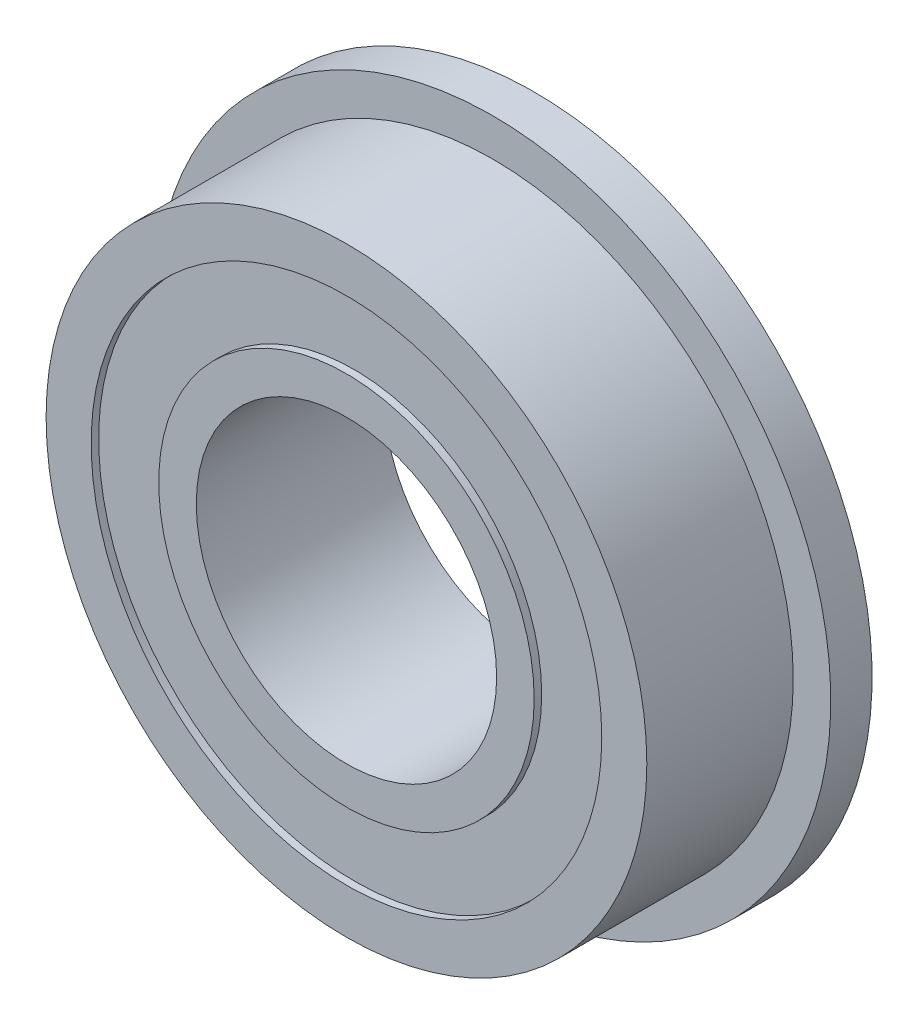
from build123d import *

# Parameters (mm, degrees)
SKETCH_1_R          = 8
EXTRUDE_1_DEPTH     = 2.5
SKETCH_4_R          = 9
EXTRUDE_2_DEPTH     = 1.1
SKETCH_2_R          = 4
CUT_EXTRUDE_1_DEPTH = 14.674794331
SKETCH_3_R          = 6.8
SKETCH_3_R_2        = 5
CUT_EXTRUDE_2_DEPTH = 0.2


with BuildPart() as part:
    # 草圖1 → 填料-伸長1 (new, symmetric)
    with BuildSketch(Plane.XY):
        Circle(SKETCH_1_R)
    extrude(amount=EXTRUDE_1_DEPTH, both=True)

    # 草圖4 → 填料-伸長2 (add)
    with BuildSketch(Plane(origin=(0, 0, -2.5), x_dir=(-1, 0, 0), z_dir=(0, 0, -1))):
        Circle(SKETCH_4_R)
    extrude(amount=-EXTRUDE_2_DEPTH)

    # 草圖2 → 除料-伸長1 (cut, through all)
    with BuildSketch(Plane.XY.offset(2.5)):
        Circle(SKETCH_2_R)
    extrude(amount=-CUT_EXTRUDE_1_DEPTH, mode=Mode.SUBTRACT)

    # 草圖3 → 除料-伸長2 (cut)
    with BuildSketch(Plane.XY.offset(2.5)):
        Circle(SKETCH_3_R)
        Circle(SKETCH_3_R_2, mode=Mode.SUBTRACT)
    cut_extrude_2 = extrude(amount=-CUT_EXTRUDE_2_DEPTH, mode=Mode.SUBTRACT)

    # 鏡射1: 除料-伸長2 across plane
    add(cut_extrude_2.mirror(Plane.XY), mode=Mode.SUBTRACT)


solid = part.part
